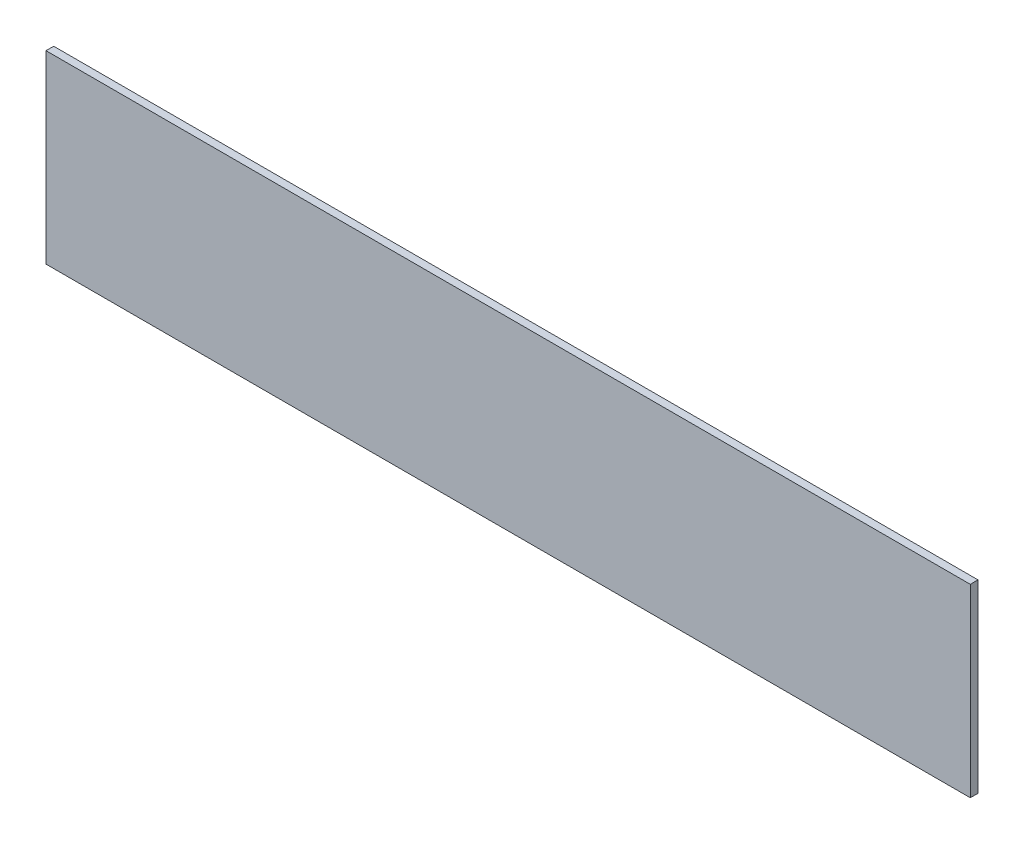
from build123d import *

# Parameters (mm, degrees)
SKETCH1_W           = 190.5
SKETCH1_H           = 38.1
BOSS_EXTRUDE1_DEPTH = 1.5875


with BuildPart() as part:
    # Sketch1 → Boss-Extrude1 (new body)
    with BuildSketch(Plane.XY):
        with Locations((95.25, 19.05)):
            Rectangle(SKETCH1_W, SKETCH1_H)
    extrude(amount=BOSS_EXTRUDE1_DEPTH)


solid = part.part
